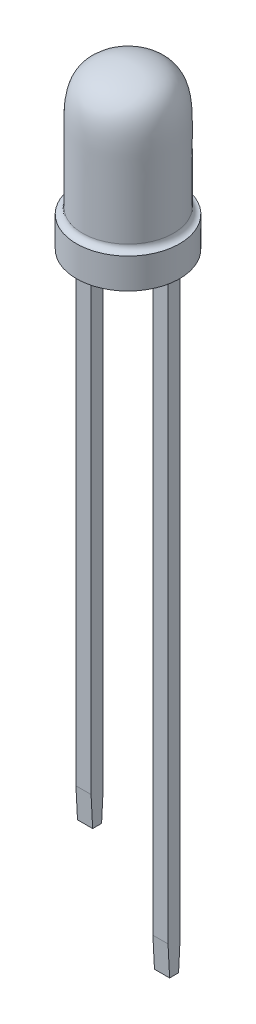
from build123d import *
from OCP.BRepFilletAPI import BRepFilletAPI_MakeChamfer

# Parameters (mm, degrees)
FILLET1_R                  = 0.2
BOSS_EXTRUDE1_DEPTH        = 17
BOSS_EXTRUDE1_DEPTH_BACK   = 0.7
SKETCH2_W                  = 0.5
SKETCH2_H                  = 0.4
BOSS_EXTRUDE1_2_DEPTH      = 17
BOSS_EXTRUDE1_2_DEPTH_BACK = 0.7
SKETCH3_W                  = 0.5
SKETCH3_H                  = 0.4
BOSS_EXTRUDE2_DEPTH        = 3
CHAMFER1_SIZE              = 1
CHAMFER1_SIZE2             = 0.052407779
CHAMFER2_SIZE              = 1
CHAMFER2_SIZE2             = 0.052407779
BOSS_EXTRUDE3_DEPTH        = 0.4
BOSS_EXTRUDE3_2_DEPTH      = 0.4
FILLET2_R                  = 0.1
FILLET3_R                  = 0.1


with BuildPart() as part:
    # Sketch1 → Revolve2 (revolve)
    with BuildSketch(Plane.XY, mode=Mode.PRIVATE) as revolve2_sk:
        with BuildLine():
            Line((0, 0), (0, 5.35))
            add(Edge.make_bspline(
                [(0, 5.35), (-0.296223224, 5.35), (-1.499904297, 5.149386401), (-1.500087174, 3.099357507), (-1.49986439, 1.755454147), (-1.49986439, 1)],
                knots=[0, 0, 0, 0, 0.21689314, 0.523318802, 1, 1, 1, 1], degree=3))
            Line((-1.49986439, 1), (-1.7, 1))
            Line((-1.7, 1), (-1.7, 0))
            Line((-1.7, 0), (0, 0))
        make_face()
    revolve(revolve2_sk.sketch.rotate(Axis((0, 0, 0), (0, 1, 0)), 270), axis=Axis((0, 0, 0), (0, 1, 0)))

    # Fillet1
    fillet1_edges = [part.edges().sort_by_distance(p)[0] for p in [
        (0, 1, 1.49986439),
    ]]
    fillet(fillet1_edges, radius=FILLET1_R)


with BuildPart() as body_2:
    # Sketch2 → Boss-Extrude1 (new, two sides: drawn at the far end of the back side and taken through both)
    with BuildSketch(Plane.XZ.offset(-BOSS_EXTRUDE1_DEPTH_BACK)):
        with Locations((-1.27, 0)):
            Rectangle(SKETCH2_W, SKETCH2_H)
    extrude(amount=BOSS_EXTRUDE1_DEPTH + BOSS_EXTRUDE1_DEPTH_BACK)

    # Chamfer1: one chamfer whose edges measure the first distance from different faces: ONE call of the kernel's chamfer builder (chamfer() names one face for all edges)
    chamfer1_edges_1 = [body_2.edges().sort_by_distance(p)[0] for p in [
        (-1.27, -17, 0.2),
    ]]
    chamfer1_side_1 = [body_2.faces().sort_by_distance(p)[0] for p in [
        (-1.27, -8.15, 0.2),
    ]]
    chamfer1_edges_2 = [body_2.edges().sort_by_distance(p)[0] for p in [
        (-1.27, -17, -0.2),
    ]]
    chamfer1_side_2 = [body_2.faces().sort_by_distance(p)[0] for p in [
        (-1.27, -8.15, -0.2),
    ]]
    chamfer1 = BRepFilletAPI_MakeChamfer(body_2.part.solid().wrapped)
    for e in chamfer1_edges_1:
        chamfer1.Add(CHAMFER1_SIZE, CHAMFER1_SIZE2, e.wrapped, chamfer1_side_1[0].wrapped)  # the first distance lies on this face
    for e in chamfer1_edges_2:
        chamfer1.Add(CHAMFER1_SIZE, CHAMFER1_SIZE2, e.wrapped, chamfer1_side_2[0].wrapped)  # the first distance lies on this face
    add(Compound.cast(chamfer1.Shape()), mode=Mode.REPLACE)


with BuildPart() as body_3:
    # Sketch2 → Boss-Extrude1 2 (new, two sides: drawn at the far end of the back side and taken through both)
    with BuildSketch(Plane.XZ.offset(-BOSS_EXTRUDE1_2_DEPTH_BACK)):
        with Locations((1.27, 0)):
            Rectangle(SKETCH2_W, SKETCH2_H)
    extrude(amount=BOSS_EXTRUDE1_2_DEPTH + BOSS_EXTRUDE1_2_DEPTH_BACK)

    # Sketch3 → Boss-Extrude2 (add)
    with BuildSketch(Plane.XZ.offset(17)):
        with Locations((1.27, 0)):
            Rectangle(SKETCH3_W, SKETCH3_H)
    extrude(amount=BOSS_EXTRUDE2_DEPTH)

    # Chamfer2: one chamfer whose edges measure the first distance from different faces: ONE call of the kernel's chamfer builder (chamfer() names one face for all edges)
    chamfer2_edges_1 = [body_3.edges().sort_by_distance(p)[0] for p in [
        (1.27, -20, -0.2),
    ]]
    chamfer2_side_1 = [body_3.faces().sort_by_distance(p)[0] for p in [
        (1.27, -9.65, -0.2),
    ]]
    chamfer2_edges_2 = [body_3.edges().sort_by_distance(p)[0] for p in [
        (1.27, -20, 0.2),
    ]]
    chamfer2_side_2 = [body_3.faces().sort_by_distance(p)[0] for p in [
        (1.27, -9.65, 0.2),
    ]]
    chamfer2 = BRepFilletAPI_MakeChamfer(body_3.part.solid().wrapped)
    for e in chamfer2_edges_1:
        chamfer2.Add(CHAMFER2_SIZE, CHAMFER2_SIZE2, e.wrapped, chamfer2_side_1[0].wrapped)  # the first distance lies on this face
    for e in chamfer2_edges_2:
        chamfer2.Add(CHAMFER2_SIZE, CHAMFER2_SIZE2, e.wrapped, chamfer2_side_2[0].wrapped)  # the first distance lies on this face
    add(Compound.cast(chamfer2.Shape()), mode=Mode.REPLACE)


with BuildPart() as body_4:
    # Sketch4 → Boss-Extrude3 (new body)
    with BuildSketch(Plane.XY.offset(0.2)):
        with BuildLine():
            Line((-1.52, 0.7), (-1.52, 0.9))
            ThreePointArc((-1.52, 0.9), (-1.461421356, 1.041421356), (-1.32, 1.1))
            Line((-1.32, 1.1), (-1.27, 1.1))
            ThreePointArc((-1.27, 1.1), (-1.163933983, 1.143933983), (-1.12, 1.25))
            Line((-1.12, 1.25), (-1.12, 2.85))
            ThreePointArc((-1.12, 2.85), (-1.105355339, 2.885355339), (-1.07, 2.9))
            Line((-1.07, 2.9), (0.63, 2.9))
            ThreePointArc((0.63, 2.9), (0.665355339, 2.885355339), (0.68, 2.85))
            Line((0.68, 2.85), (0.68, 2.520710678))
            ThreePointArc((0.68, 2.520710678), (0.676193977, 2.501576507), (0.665355339, 2.485355339))
            Line((0.665355339, 2.485355339), (-0.105355339, 1.714644661))
            ThreePointArc((-0.105355339, 1.714644661), (-0.121576507, 1.703806023), (-0.140710678, 1.7))
            Line((-0.140710678, 1.7), (-0.67, 1.7))
            ThreePointArc((-0.67, 1.7), (-0.705355339, 1.685355339), (-0.72, 1.65))
            Line((-0.72, 1.65), (-0.72, 0.9))
            ThreePointArc((-0.72, 0.9), (-0.778578644, 0.758578644), (-0.92, 0.7))
            Line((-0.92, 0.7), (-1.52, 0.7))
        make_face()
    extrude(amount=-BOSS_EXTRUDE3_DEPTH)


with BuildPart() as body_5:
    # Sketch4 → Boss-Extrude3 2 (new body)
    with BuildSketch(Plane.XY.offset(0.2)):
        with BuildLine():
            Line((0.92, 0.7), (1.52, 0.7))
            Line((1.52, 0.7), (1.52, 0.9))
            ThreePointArc((1.52, 0.9), (1.461421356, 1.041421356), (1.32, 1.1))
            Line((1.32, 1.1), (1.27, 1.1))
            ThreePointArc((1.27, 1.1), (1.163933983, 1.143933983), (1.12, 1.25))
            Line((1.12, 1.25), (1.12, 2.85))
            ThreePointArc((1.12, 2.85), (1.105355339, 2.885355339), (1.07, 2.9))
            Line((1.07, 2.9), (0.82, 2.9))
            ThreePointArc((0.82, 2.9), (0.784644661, 2.885355339), (0.77, 2.85))
            Line((0.77, 2.85), (0.77, 2.470710678))
            ThreePointArc((0.77, 2.470710678), (0.766193977, 2.451576507), (0.755355339, 2.435355339))
            Line((0.755355339, 2.435355339), (0.187071068, 1.867071068))
            ThreePointArc((0.187071068, 1.867071068), (0.18490334, 1.856173166), (0.194142136, 1.85))
            Line((0.194142136, 1.85), (0.67, 1.85))
            ThreePointArc((0.67, 1.85), (0.705355339, 1.835355339), (0.72, 1.8))
            Line((0.72, 1.8), (0.72, 0.9))
            ThreePointArc((0.72, 0.9), (0.778578644, 0.758578644), (0.92, 0.7))
        make_face()
    extrude(amount=-BOSS_EXTRUDE3_2_DEPTH)

    # Combine2: union body 3
    add(body_3.part)

    # Fillet3
    fillet3_edges = [body_5.edges().sort_by_distance(p)[0] for p in [
        (1.02, 0.7, 0),
    ]]
    fillet(fillet3_edges, radius=FILLET3_R - 0.0001)  # a hair under: the kernel refuses the full size


with BuildPart() as body_2_1:
    add(body_2.part)

    # Combine1: union body 4
    add(body_4.part)

    # Fillet2
    fillet2_edges = [body_2_1.edges().sort_by_distance(p)[0] for p in [
        (-1.02, 0.7, 0),
    ]]
    fillet(fillet2_edges, radius=FILLET2_R - 0.0001)  # a hair under: the kernel refuses the full size


solid = Compound([part.part, body_5.part, body_2_1.part])
